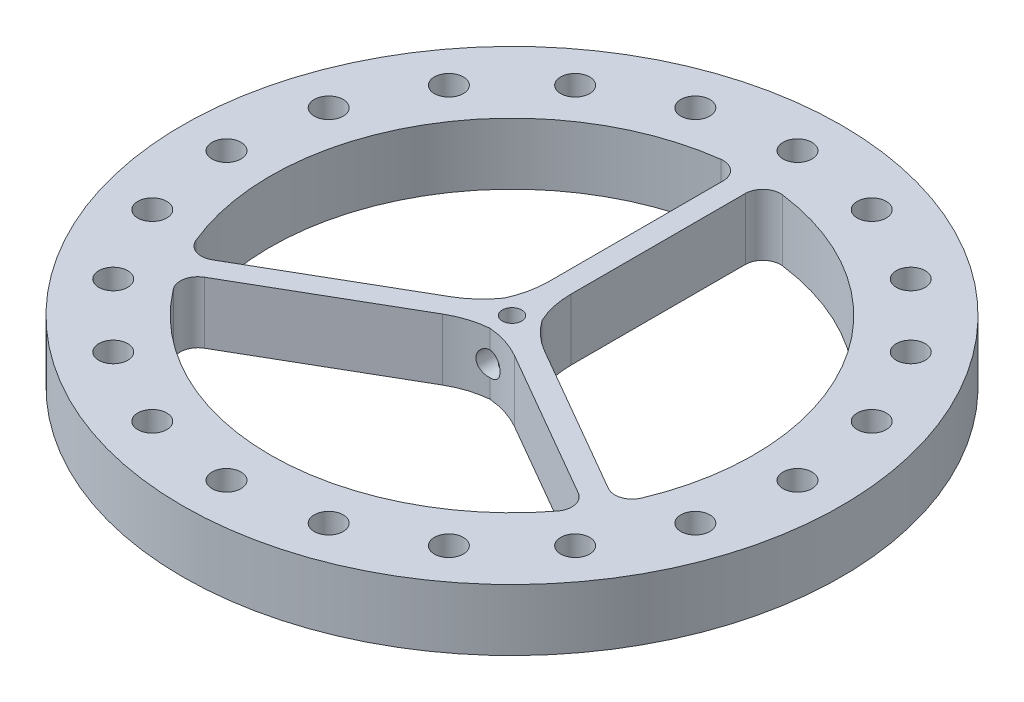
from build123d import *

# Parameters (mm, degrees)
SKETCH1_R           = 2.5
SKETCH1_R_2         = 1.1
BOSS_EXTRUDE1_DEPTH = 5
SKETCH4_R           = 37.5
SKETCH4_R_2         = 27.5
BOSS_EXTRUDE2_DEPTH = 5
SKETCH5_W           = 2.5
SKETCH5_H           = 25.334936491
BOSS_EXTRUDE3_DEPTH = 5
CIRPATTERN1_COUNT   = 3
SKETCH6_R           = 1.65
CUT_EXTRUDE1_DEPTH  = 5
FILLET1_R           = 10
FILLET2_R           = 2
CIRPATTERN2_COUNT   = 20
BOSS_EXTRUDE4_START = 2
SKETCH7_R           = 37.5
BOSS_EXTRUDE4_DEPTH = 2
CUT_EXTRUDE2_START  = -3
SKETCH8_R           = 1.1
CUT_EXTRUDE2_DEPTH  = 3
CUT_EXTRUDE3_REACH  = 55.268
SKETCH9_R           = 1.375


with BuildPart() as part:
    # Sketch1 → Boss-Extrude1 (new body)
    with BuildSketch(Plane(origin=(0, 0, 0), x_dir=(1, 0, 0), z_dir=(0, 1, 0))):
        with Locations(Location((0, 0, 0), (0, 0, 270))):
            Circle(SKETCH1_R)
        with Locations(Location((0, 0, 0), (0, 0, 270))):
            Circle(SKETCH1_R_2, mode=Mode.SUBTRACT)
    extrude(amount=BOSS_EXTRUDE1_DEPTH)



with BuildPart() as body_2:
    # Sketch4 → Boss-Extrude2 (new body)
    with BuildSketch(Plane(origin=(0, 0, 0), x_dir=(1, 0, 0), z_dir=(0, 1, 0))):
        with Locations(Location((0, 0, 0), (0, 0, 270))):
            Circle(SKETCH4_R)
        with Locations(Location((0, 0, 0), (0, 0, 270))):
            Circle(SKETCH4_R_2, mode=Mode.SUBTRACT)
    extrude(amount=BOSS_EXTRUDE2_DEPTH)


with BuildPart() as part_1:
    add(part.part)

    add(body_2.part)  # Boss-Extrude3 merges body 2
    # Sketch5 → Boss-Extrude3 (add)
    with BuildSketch(Plane(origin=(0, 5, 0), x_dir=(1, 0, 0), z_dir=(0, 1, 0))):
        with Locations((0, 14.832531754)):
            Rectangle(SKETCH5_W, SKETCH5_H)
    boss_extrude3 = extrude(amount=-BOSS_EXTRUDE3_DEPTH)

    # CirPattern1: Boss-Extrude3 ×3 about axis
    cirpattern1_axis = Axis((0, 0, 0), (0, 1, 0))
    for i in range(1, CIRPATTERN1_COUNT):
        add(boss_extrude3.rotate(cirpattern1_axis, i * 360 / CIRPATTERN1_COUNT))

    # Sketch6 → Cut-Extrude1 (cut)
    with BuildSketch(Plane(origin=(0, 5, 0), x_dir=(1, 0, 0), z_dir=(0, 1, 0))):
        with Locations(Location((0, 32.48578811, 0), (0, 0, 270))):
            Circle(SKETCH6_R)
    cut_extrude1 = extrude(amount=-CUT_EXTRUDE1_DEPTH, mode=Mode.SUBTRACT)

    # Fillet1
    # the kernel refuses this fillet: 10 mm, written as the material it adds along each edge
    with BuildSketch(Plane(origin=(-2.5, 5, 0), x_dir=(0.2936905499300681, 0, -0.9559005496816989), z_dir=(0, -1, 0))) as fillet1_piece_1:
        with BuildLine():
            CenterArc((4.405358249, -9.559005497), FILLET1_R, 107.079033618, 25.841932763)
            Line((-2.404530597, -2.236067977), (0, 0))
            ThreePointArc((0, 0), (0.734226375, -0.110248626), (1.46845275, 0))
        make_face()
    extrude(amount=5)
    with BuildSketch(Plane(origin=(-1.25, 5, -2.165063509), x_dir=(-0.680988884550829, 0, 0.7322937519317079), z_dir=(0, -1, 0))) as fillet1_piece_2:
        with BuildLine():
            CenterArc((4.405358249, 9.559005497), FILLET1_R, 227.079033618, 25.841932763)
            Line((-2.404530597, 2.236067977), (0, 0))
            ThreePointArc((0, 0), (0.734226375, 0.110248626), (1.46845275, 0))
        make_face()
    extrude(amount=5)
    with BuildSketch(Plane(origin=(1.25, 5, -2.165063509), x_dir=(0, 0, -1), z_dir=(0, -1, 0)), Plane(origin=(1.25, 5, 2.165063509), x_dir=(0.8660254037844383, 0, 0.5000000000000007), z_dir=(0, -1, 0))) as fillet1_piece_3:
        with BuildLine():
            CenterArc((3.28356017, 10), FILLET1_R, 244.158067237, 25.841932763)
            ThreePointArc((-1.075338774, 1), (-0.462591298, 0.58073438), (0, 0))
            Line((0, 0), (3.28356017, 0))
        make_face()
    extrude(amount=5)
    with BuildSketch(Plane(origin=(2.5, 5, 0), x_dir=(0.8660254037844385, 0, 0.5000000000000002), z_dir=(0, -1, 0)), Plane(origin=(-1.25, 5, 2.165063509), x_dir=(-0.8660254037844385, 0, 0.5000000000000003), z_dir=(0, -1, 0))) as fillet1_piece_4:
        with BuildLine():
            CenterArc((3.28356017, -10), FILLET1_R, 90, 25.841932763)
            ThreePointArc((-1.075338774, -1), (-0.462591298, -0.58073438), (0, 0))
            Line((0, 0), (3.28356017, 0))
        make_face()
    extrude(amount=5)

    # Fillet2
    fillet2_edges = [part_1.edges().sort_by_distance(p)[0] for p in [
        (1.25, 2.5, -27.47157622),
        (-1.25, 2.5, -27.47157622),
        (24.416082888, 2.5, 12.653256355),
        (23.166082888, 2.5, 14.818319865),
        (-24.416082888, 2.5, 12.653256355),
        (-23.166082888, 2.5, 14.818319865),
    ]]
    fillet(fillet2_edges, radius=FILLET2_R)

    # CirPattern2: Cut-Extrude1 ×20 about axis
    cirpattern2_axis = Axis((0, 0, 0), (0, 1, 0))
    for i in range(1, CIRPATTERN2_COUNT):
        add(cut_extrude1.rotate(cirpattern2_axis, i * 360 / CIRPATTERN2_COUNT), mode=Mode.SUBTRACT)

    # Sketch7 → Boss-Extrude4 (add)
    with BuildSketch(Plane.XZ.offset(BOSS_EXTRUDE4_START)):
        with Locations(Location((0, 0, 0), (0, 0, 270))):
            Circle(SKETCH7_R)
        Polygon((11.019921348, 33.915830515), (7.913885555, 33.255622227), (6.932624808, 30.23561218), (9.057399855, 27.875810423), (12.163435648, 28.536018711), (13.144696395, 31.556028758), align=None, mode=Mode.SUBTRACT)
        Polygon((0, 35.66121459), (-2.75, 34.07350135), (-2.75, 30.89807487), (0, 29.310361629), (2.75, 30.89807487), (2.75, 34.07350135), align=None, mode=Mode.SUBTRACT)
        Polygon((20.961136015, 28.850528644), (17.803104853, 29.182451094), (15.936635998, 26.613477107), (17.228198305, 23.712580669), (20.386229467, 23.380658219), (22.252698322, 25.949632206), align=None, mode=Mode.SUBTRACT)
        Polygon((28.850528644, 20.961136015), (25.949632206, 22.252698322), (23.380658219, 20.386229467), (23.712580669, 17.228198305), (26.613477107, 15.936635998), (29.182451094, 17.803104853), align=None, mode=Mode.SUBTRACT)
        Polygon((33.915830515, 11.019921348), (31.556028758, 13.144696395), (28.536018711, 12.163435648), (27.875810423, 9.057399855), (30.23561218, 6.932624808), (33.255622227, 7.913885555), align=None, mode=Mode.SUBTRACT)
        Polygon((35.66121459, 0), (34.07350135, 2.75), (30.89807487, 2.75), (29.310361629, 0), (30.89807487, -2.75), (34.07350135, -2.75), align=None, mode=Mode.SUBTRACT)
        Polygon((33.915830515, -11.019921348), (33.255622227, -7.913885555), (30.23561218, -6.932624808), (27.875810423, -9.057399855), (28.536018711, -12.163435648), (31.556028758, -13.144696395), align=None, mode=Mode.SUBTRACT)
        Polygon((28.850528644, -20.961136015), (29.182451094, -17.803104853), (26.613477107, -15.936635998), (23.712580669, -17.228198305), (23.380658219, -20.386229467), (25.949632206, -22.252698322), align=None, mode=Mode.SUBTRACT)
        Polygon((20.961136015, -28.850528644), (22.252698322, -25.949632206), (20.386229467, -23.380658219), (17.228198305, -23.712580669), (15.936635998, -26.613477107), (17.803104853, -29.182451094), align=None, mode=Mode.SUBTRACT)
        Polygon((11.019921348, -33.915830515), (13.144696395, -31.556028758), (12.163435648, -28.536018711), (9.057399855, -27.875810423), (6.932624808, -30.23561218), (7.913885555, -33.255622227), align=None, mode=Mode.SUBTRACT)
        Polygon((0, -35.66121459), (2.75, -34.07350135), (2.75, -30.89807487), (0, -29.310361629), (-2.75, -30.89807487), (-2.75, -34.07350135), align=None, mode=Mode.SUBTRACT)
        Polygon((-11.019921348, -33.915830515), (-7.913885555, -33.255622227), (-6.932624808, -30.23561218), (-9.057399855, -27.875810423), (-12.163435648, -28.536018711), (-13.144696395, -31.556028758), align=None, mode=Mode.SUBTRACT)
        Polygon((-20.961136015, -28.850528644), (-17.803104853, -29.182451094), (-15.936635998, -26.613477107), (-17.228198305, -23.712580669), (-20.386229467, -23.380658219), (-22.252698322, -25.949632206), align=None, mode=Mode.SUBTRACT)
        Polygon((-28.850528644, -20.961136015), (-25.949632206, -22.252698322), (-23.380658219, -20.386229467), (-23.712580669, -17.228198305), (-26.613477107, -15.936635998), (-29.182451094, -17.803104853), align=None, mode=Mode.SUBTRACT)
        Polygon((-33.915830515, -11.019921348), (-31.556028758, -13.144696395), (-28.536018711, -12.163435648), (-27.875810423, -9.057399855), (-30.23561218, -6.932624808), (-33.255622227, -7.913885555), align=None, mode=Mode.SUBTRACT)
        Polygon((-35.66121459, 0), (-34.07350135, -2.75), (-30.89807487, -2.75), (-29.310361629, 0), (-30.89807487, 2.75), (-34.07350135, 2.75), align=None, mode=Mode.SUBTRACT)
        Polygon((-33.915830515, 11.019921348), (-33.255622227, 7.913885555), (-30.23561218, 6.932624808), (-27.875810423, 9.057399855), (-28.536018711, 12.163435648), (-31.556028758, 13.144696395), align=None, mode=Mode.SUBTRACT)
        Polygon((-28.850528644, 20.961136015), (-29.182451094, 17.803104853), (-26.613477107, 15.936635998), (-23.712580669, 17.228198305), (-23.380658219, 20.386229467), (-25.949632206, 22.252698322), align=None, mode=Mode.SUBTRACT)
        Polygon((-20.961136015, 28.850528644), (-22.252698322, 25.949632206), (-20.386229467, 23.380658219), (-17.228198305, 23.712580669), (-15.936635998, 26.613477107), (-17.803104853, 29.182451094), align=None, mode=Mode.SUBTRACT)
        Polygon((-11.019921348, 33.915830515), (-13.144696395, 31.556028758), (-12.163435648, 28.536018711), (-9.057399855, 27.875810423), (-6.932624808, 30.23561218), (-7.913885555, 33.255622227), align=None, mode=Mode.SUBTRACT)
    extrude(amount=-BOSS_EXTRUDE4_DEPTH)

    # Sketch8 → Cut-Extrude2 (cut)
    with BuildSketch(Plane(origin=(0, 0, 0), x_dir=(1, 0, 0), z_dir=(0, 1, 0)).offset(CUT_EXTRUDE2_START)):
        with Locations(Location((0, 0, 0), (0, 0, 90))):
            Circle(SKETCH8_R)
        with BuildLine():
            Line((-1.25, 5.448623679), (-1.25, 25.292044204))
            ThreePointArc((-1.25, 25.292044204), (-1.928978411, 26.793677302), (-3.504901961, 27.275733945))
            ThreePointArc((-3.504901961, 27.275733945), (-23.815698604, 13.75), (-25.373929484, -10.602532837))
            ThreePointArc((-25.373929484, -10.602532837), (-24.168494409, -11.726294344), (-22.528552794, -11.563490347))
            Line((-22.528552794, -11.563490347), (-5.343646522, -1.641780085))
            ThreePointArc((-5.343646522, -1.641780085), (-3.600632907, -0.366088823), (-2.172213558, 1.254128082))
            ThreePointArc((-2.172213558, 1.254128082), (-1.483274233, 3.301283979), (-1.25, 5.448623679))
        make_face()
        with BuildLine():
            Line((-4.093646522, -3.806843594), (-21.278552794, -13.728553857))
            ThreePointArc((-21.278552794, -13.728553857), (-22.239515999, -15.067382958), (-21.869027523, -16.673201108))
            ThreePointArc((-21.869027523, -16.673201108), (0, -27.5), (21.869027523, -16.673201108))
            ThreePointArc((21.869027523, -16.673201108), (22.239515999, -15.067382958), (21.278552794, -13.728553857))
            Line((21.278552794, -13.728553857), (4.093646522, -3.806843594))
            ThreePointArc((4.093646522, -3.806843594), (2.117358674, -2.935195156), (0, -2.508256165))
            ThreePointArc((0, -2.508256165), (-2.117358674, -2.935195156), (-4.093646522, -3.806843594))
        make_face()
        with BuildLine():
            Line((1.25, 25.292044204), (1.25, 5.448623679))
            ThreePointArc((1.25, 5.448623679), (1.483274233, 3.301283979), (2.172213558, 1.254128082))
            ThreePointArc((2.172213558, 1.254128082), (3.600632907, -0.366088823), (5.343646522, -1.641780085))
            Line((5.343646522, -1.641780085), (22.528552794, -11.563490347))
            ThreePointArc((22.528552794, -11.563490347), (24.168494409, -11.726294344), (25.373929484, -10.602532837))
            ThreePointArc((25.373929484, -10.602532837), (23.815698604, 13.75), (3.504901961, 27.275733945))
            ThreePointArc((3.504901961, 27.275733945), (1.928978411, 26.793677302), (1.25, 25.292044204))
        make_face()
    extrude(amount=CUT_EXTRUDE2_DEPTH, mode=Mode.SUBTRACT)

    # Sketch9 → Cut-Extrude3 (cut, up to next)
    with BuildSketch(Plane.XY, mode=Mode.PRIVATE) as cut_extrude3_sk1:
        with Locations(Location((0, 1.5, 0), (0, 0, 216.869897646))):
            Circle(SKETCH9_R)
    cut_extrude3_tool1 = extrude(cut_extrude3_sk1.sketch, amount=CUT_EXTRUDE3_REACH, mode=Mode.PRIVATE) & part_1.part
    add(cut_extrude3_tool1.solids().sort_by_distance((0, 1.5, 0))[0], mode=Mode.SUBTRACT)


solid = part_1.part
